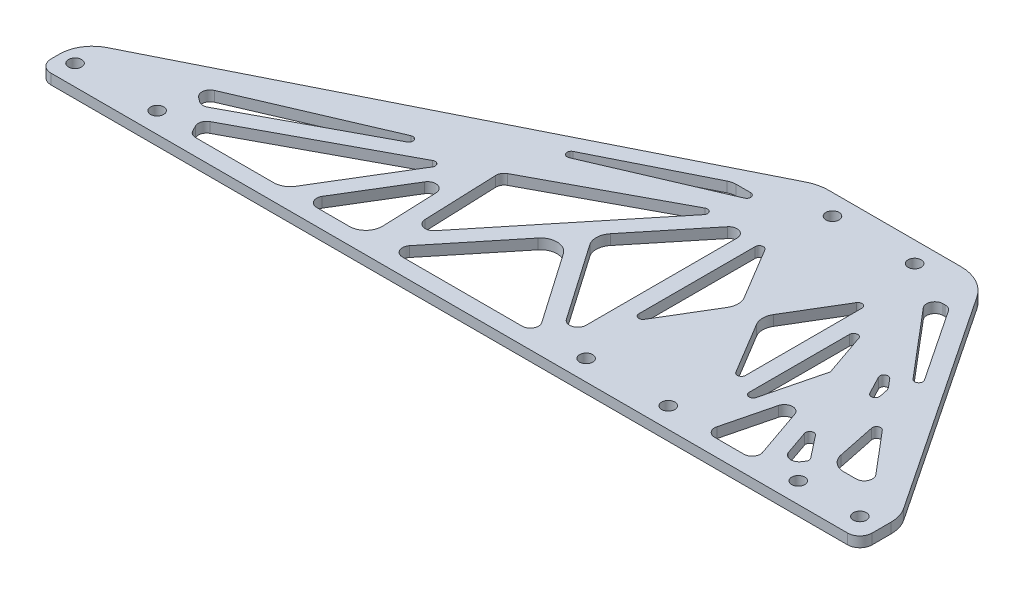
from build123d import *

# Parameters (mm, degrees)
SKETCH1_R           = 2.032
BOSS_EXTRUDE1_DEPTH = 3.175
SKETCH1_3_R         = 2.032
CUT_EXTRUDE2_DEPTH  = 270.126904313
FILLET1_R           = 3.81
FILLET2_R           = 10.16
FILLET3_R           = 12.7
FILLET4_R           = 1.27
FILLET5_R           = 2.54
FILLET6_R           = 5.08


with BuildPart() as part:
    # Sketch1 → Boss-Extrude1 (new body)
    with BuildSketch(Plane(origin=(0, 0, 0), x_dir=(1, 0, 0), z_dir=(0, 1, 0))):
        Polygon((0, 0), (254, 0), (254, 12.7), (203.2, 88.9), (152.4, 88.9), (0, 12.7), align=None)
        with Locations((4.868333333, 6.35)):
            Circle(SKETCH1_R, mode=Mode.SUBTRACT)
        with Locations((30.268333333, 6.35)):
            Circle(SKETCH1_R, mode=Mode.SUBTRACT)
        with Locations((228.6, 6.35)):
            Circle(SKETCH1_R, mode=Mode.SUBTRACT)
        with Locations((247.65, 6.35)):
            Circle(SKETCH1_R, mode=Mode.SUBTRACT)
        with Locations((162.983333333, 82.55)):
            Circle(SKETCH1_R, mode=Mode.SUBTRACT)
        with Locations((188.383333333, 82.55)):
            Circle(SKETCH1_R, mode=Mode.SUBTRACT)
    extrude(amount=BOSS_EXTRUDE1_DEPTH)

    # Sketch1<3> → Cut-Extrude2 (cut, through all)
    with BuildSketch(Plane(origin=(0, 0, 0), x_dir=(1, 0, 0), z_dir=(0, 1, 0))):
        Polygon((39.160127309, 10.433958769), (41.874510307, 5.08), (70.459110655, 5.08), (90.331883407, 37.826895453), align=None)
        Polygon((76.401361816, 5.08), (96.288373818, 5.08), (95.107733837, 35.904868603), align=None)
        Polygon((127.570752901, 36.414671497), (102.103358932, 5.08), (149.298298116, 5.08), align=None)
        Polygon((150.195302167, 76.2), (138.359225326, 76.2), (66.419120067, 40.229947371), align=None)
        Polygon((29.646805141, 18.912972806), (35.757110623, 14.374351834), (103.353340378, 50.559532546), align=None)
        Polygon((154.093333333, 69.047627429), (130.906568677, 40.519005519), (154.093333333, 7.079901082), align=None)
        Polygon((146.694432915, 67.998534414), (99.921228518, 42.960202251), (101.110396846, 11.912670369), align=None)
        with Locations((162.983333333, 6.35)):
            Circle(SKETCH1_3_R)
        Polygon((233.45048443, 34.366173115), (205.561266507, 76.2), (198.060312203, 76.2), align=None)
        Polygon((207.411621605, 31.741918623), (200.727780974, 5.08), (216.626583121, 5.08), align=None)
        with Locations((188.383333333, 6.35)):
            Circle(SKETCH1_3_R)
        Polygon((214.360813589, 27.186853093), (221.088734871, 7.720760975), (225.03662739, 13.595166828), align=None)
        Polygon((197.273333333, 61.075325647), (197.273333333, 12.191395039), (204.376138918, 40.524569775), align=None)
        Polygon((172.721209771, 44.45), (159.173333333, 67.029794062), (159.173333333, 21.870205938), align=None)
        Polygon((229.119714982, 15.811166321), (242.49351009, 15.811166321), (224.788319061, 36.740024529), align=None)
        Polygon((217.920532914, 44.858260713), (207.815682967, 56.802948088), (220.392582257, 32.913573338), align=None)
        Polygon((192.193333333, 67.029794062), (178.645456896, 44.45), (192.193333333, 21.870205938), align=None)
    extrude(amount=CUT_EXTRUDE2_DEPTH, mode=Mode.SUBTRACT)

    # Fillet1
    fillet1_edges = [part.edges().sort_by_distance(p)[0] for p in [
        (254, 1.5875, 0),
        (0, 1.5875, 0),
    ]]
    fillet(fillet1_edges, radius=FILLET1_R)

    # Fillet2
    fillet2_edges = [part.edges().sort_by_distance(p)[0] for p in [
        (254, 1.5875, -12.7),
        (0, 1.5875, -12.7),
    ]]
    fillet(fillet2_edges, radius=FILLET2_R)

    # Fillet3
    fillet3_edges = [part.edges().sort_by_distance(p)[0] for p in [
        (203.2, 1.5875, -88.9),
        (152.4, 1.5875, -88.9),
    ]]
    fillet(fillet3_edges, radius=FILLET3_R)

    # Fillet4
    fillet4_edges = [part.edges().sort_by_distance(p)[0] for p in [
        (214.360813589, 1.5875, -27.186853093),
        (233.45048443, 1.5875, -34.366173115),
        (207.815682967, 1.5875, -56.802948088),
        (220.392582257, 1.5875, -32.913573338),
        (197.273333333, 1.5875, -61.075325647),
        (197.273333333, 1.5875, -12.191395039),
        (159.173333333, 1.5875, -67.029794062),
        (192.193333333, 1.5875, -67.029794062),
        (192.193333333, 1.5875, -21.870205938),
        (159.173333333, 1.5875, -21.870205938),
        (146.694432915, 1.5875, -67.998534414),
        (66.419120067, 1.5875, -40.229947371),
        (150.195302167, 1.5875, -76.2),
        (224.788319061, 1.5875, -36.740024529),
        (103.353340378, 1.5875, -50.559532546),
        (90.331883407, 1.5875, -37.826895453),
        (225.03662739, 1.5875, -13.595166828),
    ]]
    fillet(fillet4_edges, radius=FILLET4_R)

    # Fillet5
    fillet5_edges = [part.edges().sort_by_distance(p)[0] for p in [
        (39.160127309, 1.5875, -10.433958769),
        (41.874510307, 1.5875, -5.08),
        (99.921228518, 1.5875, -42.960202251),
        (101.110396846, 1.5875, -11.912670369),
        (95.107733837, 1.5875, -35.904868603),
        (76.401361816, 1.5875, -5.08),
        (35.757110623, 1.5875, -14.374351834),
        (29.646805141, 1.5875, -18.912972806),
        (198.060312203, 1.5875, -76.2),
        (205.561266507, 1.5875, -76.2),
        (217.920532914, 1.5875, -44.858260713),
        (242.49351009, 1.5875, -15.811166321),
        (221.088734871, 1.5875, -7.720760975),
        (216.626583121, 1.5875, -5.08),
        (200.727780974, 1.5875, -5.08),
        (207.411621605, 1.5875, -31.741918623),
        (154.093333333, 1.5875, -69.047627429),
        (149.298298116, 1.5875, -5.08),
        (102.103358932, 1.5875, -5.08),
        (154.093333333, 1.5875, -7.079901082),
    ]]
    fillet(fillet5_edges, radius=FILLET5_R)

    # Fillet6
    fillet6_edges = [part.edges().sort_by_distance(p)[0] for p in [
        (229.119714982, 1.5875, -15.811166321),
        (96.288373818, 1.5875, -5.08),
        (172.721209771, 1.5875, -44.45),
        (178.645456896, 1.5875, -44.45),
        (130.906568677, 1.5875, -40.519005519),
        (127.570752901, 1.5875, -36.414671497),
        (138.359225326, 1.5875, -76.2),
        (70.459110655, 1.5875, -5.08),
    ]]
    fillet(fillet6_edges, radius=FILLET6_R)


solid = part.part
